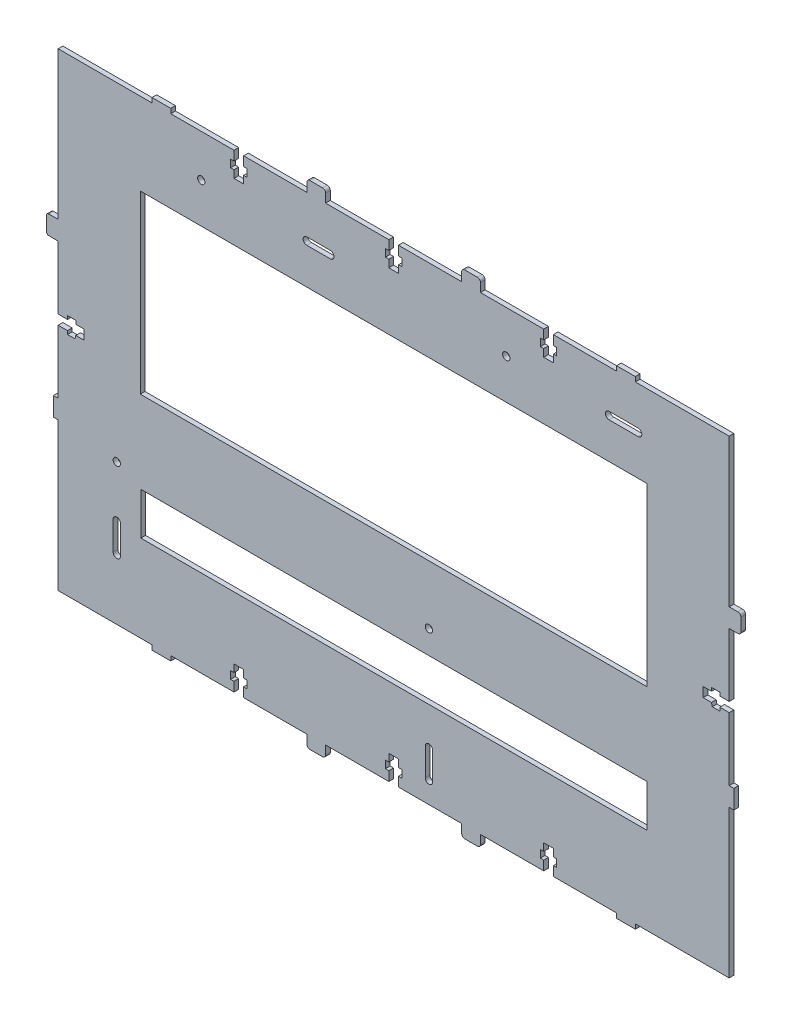
from build123d import *

# Parameters (mm, degrees)
SKETCH_1_R          = 1.55
SKETCH_1_W          = 216
SKETCH_1_H          = 75
SKETCH_1_W_2        = 215.727767244
SKETCH_1_H_2        = 18
EXTRUDE_1_DEPTH     = 2
FILLET_1_R          = 1
FILLET_2_R          = 1.3
SKETCH_4_W          = 16.091181195
SKETCH_4_H          = 8.262872831
SKETCH_4_W_2        = 19.931884343
SKETCH_4_W_3        = 14.487561678
SKETCH_4_H_2        = 5.890006991
SKETCH_4_W_4        = 16.715065691
SKETCH_4_H_3        = 8.177759915
SKETCH_4_W_5        = 10.105714663
SKETCH_4_H_4        = 26.066396506
SKETCH_4_W_6        = 5.661455371
SKETCH_4_H_5        = 27.456761526
CUT_EXTRUDE_1_DEPTH = 2


with BuildPart() as part:
    # 草图1 → 凸台-拉伸1 (new body)
    with BuildSketch(Plane.XY):
        Polygon((0, 0), (0, -4), (-1.45, -4), (-1.45, -7.2), (0, -7.2), (0, -10.4), (4.1, -10.4), (4.1, -7.2), (5.55, -7.2), (5.55, -4), (4.1, -4), (4.1, 0), (31.05, 0), (31.05, 5), (39.05, 5), (39.05, 0), (66, 0), (66, -4), (64.55, -4), (64.55, -7.2), (66, -7.2), (66, -10.4), (70.1, -10.4), (70.1, -7.2), (71.55, -7.2), (71.55, -4), (70.1, -4), (70.1, 0), (97.05, 0), (97.05, 5), (105.05, 5), (105.05, 0), (132, 0), (145.05, 0), (145.05, -63), (150.05, -63), (150.05, -71), (145.05, -71), (145.05, -97.95), (141.05, -97.95), (141.05, -96.490258022), (137.515203406, -96.490258022), (137.515203406, -97.95), (133.980406811, -97.95), (133.980406811, -102.05), (137.515203406, -102.05), (137.850237274, -103.470774067), (141.05, -103.509741978), (141.05, -102.05), (145.05, -102.05), (145.05, -129), (150.05, -129), (150.05, -137), (145.05, -137), (145.05, -200), (132, -200), (105.05, -200), (105.05, -205), (97.05, -205), (97.05, -200), (70.1, -200), (70.1, -196), (71.55, -196), (71.55, -192.8), (70.1, -192.8), (70.1, -189.6), (66, -189.6), (66, -192.8), (64.55, -192.8), (64.55, -196), (66, -196), (66, -200), (39.05, -200), (39.05, -205), (31.05, -205), (31.05, -200), (4.1, -200), (4.1, -196), (5.55, -196), (5.55, -192.8), (4.1, -192.8), (4.1, -189.6), (0, -189.6), (0, -192.8), (-1.45, -192.8), (-1.45, -196), (0, -196), (0, -200), (-26.95, -200), (-26.95, -205), (-34.95, -205), (-34.95, -200), (-61.9, -200), (-61.9, -196), (-60.45, -196), (-60.45, -192.8), (-61.9, -192.8), (-61.9, -189.6), (-66, -189.6), (-66, -192.8), (-67.45, -192.8), (-67.45, -196), (-66, -196), (-66, -200), (-92.95, -200), (-92.95, -205), (-100.95, -205), (-100.95, -200), (-127.9, -200), (-140.95, -200), (-140.95, -137), (-145.95, -137), (-145.95, -129), (-140.95, -129), (-140.95, -102.05), (-136.95, -102.05), (-136.95, -103.509741978), (-133.750237274, -103.470774067), (-133.415203406, -102.05), (-129.880406811, -102.05), (-129.880406811, -97.95), (-133.415203406, -97.95), (-133.415203406, -96.490258022), (-136.95, -96.490258022), (-136.95, -97.95), (-140.95, -97.95), (-140.95, -71), (-145.95, -71), (-145.95, -63), (-140.95, -63), (-140.95, 0), (-127.9, 0), (-100.95, 0), (-100.95, 5), (-92.95, 5), (-92.95, 0), (-66, 0), (-66, -4), (-67.45, -4), (-67.45, -7.2), (-66, -7.2), (-66, -10.4), (-61.9, -10.4), (-61.9, -7.2), (-60.45, -7.2), (-60.45, -4), (-61.9, -4), (-61.9, 0), (-34.95, 0), (-34.95, 5), (-26.95, 5), (-26.95, 0), align=None)
        with Locations((-79.95, -18)):
            Circle(SKETCH_1_R, mode=Mode.SUBTRACT)
        with Locations((50.05, -18)):
            Circle(SKETCH_1_R, mode=Mode.SUBTRACT)
        with Locations((-115.95, -140)):
            Circle(SKETCH_1_R, mode=Mode.SUBTRACT)
        with Locations((17.077210256, -135)):
            Circle(SKETCH_1_R, mode=Mode.SUBTRACT)
        with BuildLine():
            Line((-24.95, -19.562811619), (-34.95, -19.562811619))
            ThreePointArc((-34.95, -19.562811619), (-36.512811619, -18), (-34.95, -16.437188381))
            Line((-34.95, -16.437188381), (-24.95, -16.437188381))
            ThreePointArc((-24.95, -16.437188381), (-23.387188381, -18), (-24.95, -19.562811619))
        make_face(mode=Mode.SUBTRACT)
        with BuildLine():
            Line((106.249450317, -19.565072376), (93.850549683, -19.565072376))
            ThreePointArc((93.850549683, -19.565072376), (92.285477307, -18), (93.850549683, -16.434927624))
            Line((93.850549683, -16.434927624), (106.249450317, -16.434927624))
            ThreePointArc((106.249450317, -16.434927624), (107.814522693, -18), (106.249450317, -19.565072376))
        make_face(mode=Mode.SUBTRACT)
        with BuildLine():
            Line((-114.4, -161.905290892), (-114.4, -174.094709108))
            ThreePointArc((-114.4, -174.094709108), (-115.95, -175.644709108), (-117.5, -174.094709108))
            Line((-117.5, -174.094709108), (-117.5, -161.905290892))
            ThreePointArc((-117.5, -161.905290892), (-115.95, -160.355290892), (-114.4, -161.905290892))
        make_face(mode=Mode.SUBTRACT)
        with BuildLine():
            Line((15.527210256, -190.905290892), (15.527210256, -179.094709108))
            ThreePointArc((15.527210256, -179.094709108), (17.077210256, -177.544709108), (18.627210256, -179.094709108))
            Line((18.627210256, -179.094709108), (18.627210256, -190.905290892))
            ThreePointArc((18.627210256, -190.905290892), (17.077210256, -192.455290892), (15.527210256, -190.905290892))
        make_face(mode=Mode.SUBTRACT)
        with Locations((2.05, -72.5)):
            Rectangle(SKETCH_1_W, SKETCH_1_H, mode=Mode.SUBTRACT)
        with Locations((2.186116378, -154)):
            Rectangle(SKETCH_1_W_2, SKETCH_1_H_2, mode=Mode.SUBTRACT)
    extrude(amount=EXTRUDE_1_DEPTH)

    # 圆角1
    fillet_1_edges = [part.edges().sort_by_distance(p)[0] for p in [
        (-145.95, -137, 1),
        (-145.95, -129, 1),
        (-145.95, -63, 1),
        (-145.95, -71, 1),
    ]]
    fillet(fillet_1_edges, radius=FILLET_1_R)

    # 圆角2
    fillet_2_edges = [part.edges().sort_by_distance(p)[0] for p in [
        (97.05, 5, 1),
        (105.05, 5, 1),
        (39.05, 5, 1),
        (31.05, 5, 1),
        (-26.95, 5, 1),
        (-34.95, 5, 1),
        (-100.95, 5, 1),
        (-92.95, 5, 1),
        (-100.95, -205, 1),
        (-92.95, -205, 1),
        (-34.95, -205, 1),
        (-26.95, -205, 1),
        (31.05, -205, 1),
        (39.05, -205, 1),
        (97.05, -205, 1),
        (105.05, -205, 1),
        (150.05, -137, 1),
        (150.05, -129, 1),
        (150.05, -63, 1),
        (150.05, -71, 1),
    ]]
    fillet(fillet_2_edges, radius=FILLET_2_R)

    # 草图4 → 切除-拉伸1 (cut)
    with BuildSketch(Plane.XY.offset(2)):
        with Locations((-95.339833075, 6.131436416)):
            Rectangle(SKETCH_4_W, SKETCH_4_H)
        with Locations((100.859067665, 6.131436416)):
            Rectangle(SKETCH_4_W_2, SKETCH_4_H)
        with Locations((-97.37103045, -204.945003496)):
            Rectangle(SKETCH_4_W_3, SKETCH_4_H_2)
        with Locations((102.467476991, -206.088879958)):
            Rectangle(SKETCH_4_W_4, SKETCH_4_H_3)
        with Locations((-148.002857332, -124.681219337)):
            Rectangle(SKETCH_4_W_5, SKETCH_4_H_4)
        with Locations((149.880727686, -127.664492951)):
            Rectangle(SKETCH_4_W_6, SKETCH_4_H_5)
    extrude(amount=-CUT_EXTRUDE_1_DEPTH, mode=Mode.SUBTRACT)


solid = part.part
